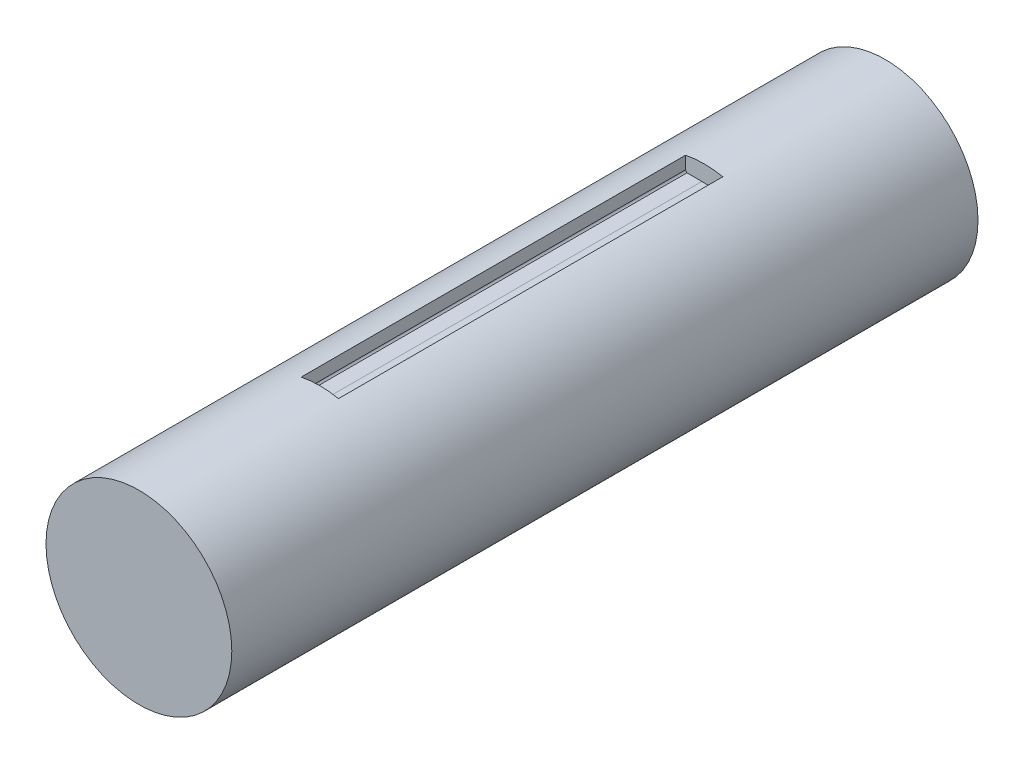
from build123d import *

# Parameters (mm, degrees)
MODEL_R                     = 24.9
Y_KSEKLIK_EKSTR_ZYON2_DEPTH = 100
KES_EKSTR_ZYON1_DEPTH       = 51.5


with BuildPart() as part:
    # Model → Yükseklik-Ekstrüzyon2 (new, symmetric)
    with BuildSketch(Plane.XY):
        Circle(MODEL_R)
    extrude(amount=Y_KSEKLIK_EKSTR_ZYON2_DEPTH, both=True)

    # Model<12> → Kes-Ekstrüzyon1 (cut, symmetric)
    with BuildSketch(Plane.XY):
        with BuildLine():
            Line((5, -24.392826814), (5, -21))
            ThreePointArc((5, -21), (4.843352342, -20.718418144), (4.605290304, -20.501270048))
            Line((4.605290304, -20.501270048), (0.605290304, -20.501270048))
            Line((0.605290304, -20.501270048), (-3.968312881, -20.353896765))
            ThreePointArc((-3.968312881, -20.353896765), (-4.684485734, -20.623865064), (-5, -21.321172159))
            Line((-5, -21.321172159), (-5, -24.392826814))
            ThreePointArc((-5, -24.392826814), (0, -24.9), (5, -24.392826814))
        make_face()
        with BuildLine():
            ThreePointArc((5, 24.392826814), (0, 24.9), (-5, 24.392826814))
            Line((-5, 24.392826814), (-5, 21))
            ThreePointArc((-5, 21), (-4.843352342, 20.718418144), (-4.605290304, 20.501270048))
            Line((-4.605290304, 20.501270048), (-0.605290304, 20.501270048))
            Line((-0.605290304, 20.501270048), (3.968312881, 20.353896765))
            ThreePointArc((3.968312881, 20.353896765), (4.684485734, 20.623865064), (5, 21.321172159))
            Line((5, 21.321172159), (5, 24.392826814))
        make_face()
    extrude(amount=KES_EKSTR_ZYON1_DEPTH, both=True, mode=Mode.SUBTRACT)


solid = part.part
